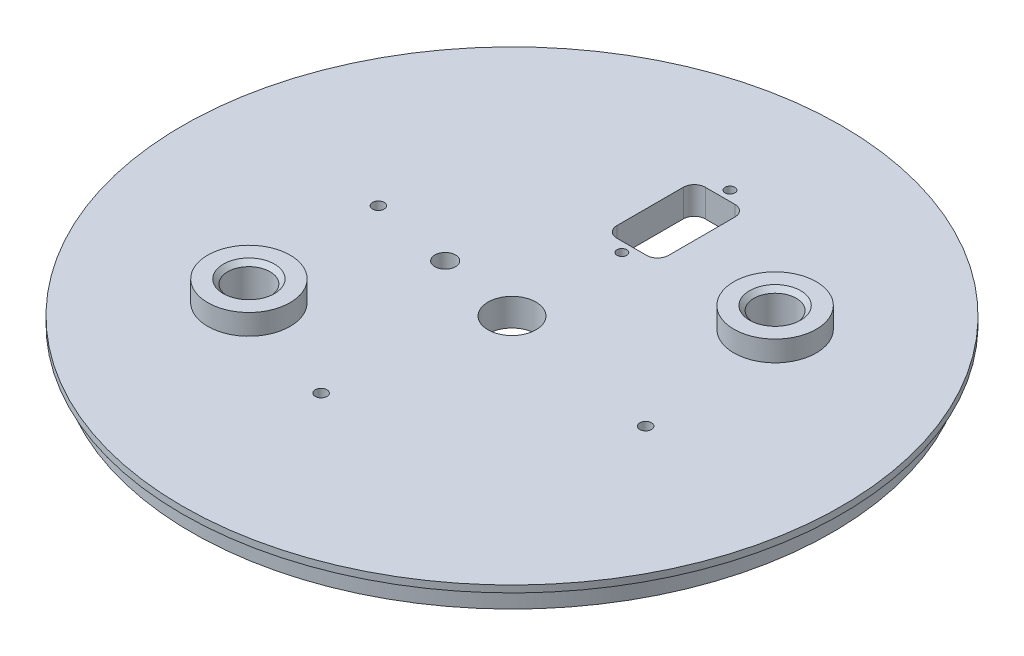
from build123d import *

# Parameters (mm, degrees)
SKETCH1_R                      = 76.2
BOSS_EXTRUDE1_DEPTH            = 11.1125
TAP_DRILL_FOR_4_40_TAP1_D      = 2.2606
CUT_EXTRUDE1_DEPTH             = 109.334517381
TAP_DRILL_FOR_6_32_TAP1_D      = 2.7051
CIRPATTERN1_COUNT              = 4
W_0_386_DIAMETER_HOLE1_D       = 9.8044
F_3_16_0_1875_DIAMETER_HOLE1_D = 4.7625
CUT_EXTRUDE4_DEPTH             = 3.175
F_7_16_0_4375_DIAMETER_HOLE1_D = 11.1125
SKETCH15_R                     = 76.2
SKETCH15_R_2                   = 74.041
CUT_EXTRUDE5_DEPTH             = 4.7625
CHAMFER2_SIZE                  = 1.016
SKETCH18_R                     = 76.2
SKETCH18_R_2                   = 9.525
SKETCH18_R_3                   = 1.35255
SKETCH18_R_4                   = 2.38125
SKETCH18_R_5                   = 5.55625
SKETCH18_R_6                   = 1.1303
CUT_EXTRUDE6_DEPTH             = 4.7625


with BuildPart() as part:
    # Sketch1 → Boss-Extrude1 (new body)
    with BuildSketch(Plane(origin=(0, 0, 0), x_dir=(1, 0, 0), z_dir=(0, 1, 0))):
        Circle(SKETCH1_R)
    extrude(amount=BOSS_EXTRUDE1_DEPTH)

    # Tap Drill for #4-40 Tap1 (through all)
    with Locations(Plane(origin=(0, 0, 0), x_dir=(-1, 0, 0), z_dir=(0, -1, 0))):
        with Locations((0, 25.4), (0, 50.400000038)):
            Hole(TAP_DRILL_FOR_4_40_TAP1_D / 2)

    # Sketch2 → Cut-Extrude1 (cut, through all)
    with BuildSketch(Plane.XZ):
        with BuildLine():
            Line((-3.429, -27.686), (3.429, -27.686))
            ThreePointArc((3.429, -27.686), (5.225051224, -28.429948776), (5.969, -30.226))
            Line((5.969, -30.226), (5.969, -45.574000038))
            ThreePointArc((5.969, -45.574000038), (5.225051224, -47.370051262), (3.429, -48.114000038))
            Line((3.429, -48.114000038), (-3.429, -48.114000038))
            ThreePointArc((-3.429, -48.114000038), (-5.225051224, -47.370051262), (-5.969, -45.574000038))
            Line((-5.969, -45.574000038), (-5.969, -30.226))
            ThreePointArc((-5.969, -30.226), (-5.225051224, -28.429948776), (-3.429, -27.686))
        make_face()
    extrude(amount=-CUT_EXTRUDE1_DEPTH, mode=Mode.SUBTRACT)

    # Tap Drill for #6-32 Tap1 (through all)
    with Locations(Plane(origin=(0, 0, 0), x_dir=(-1, 0, 0), z_dir=(0, -1, 0))):
        with Locations((37.52117539, 6.615995569)):
            tap_drill_for_6_32_tap1 = Hole(TAP_DRILL_FOR_6_32_TAP1_D / 2)

    # CirPattern1: Tap Drill for #6-32 Tap1 ×4 about axis, 1 skipped
    cirpattern1_axis = Axis((0, 0, 0), (0, 1, 0))
    add([tap_drill_for_6_32_tap1.rotate(cirpattern1_axis, i * 360 / CIRPATTERN1_COUNT) for i in range(1, CIRPATTERN1_COUNT) if i not in (3,)], mode=Mode.SUBTRACT)

    # W (0.386) Diameter Hole1 (through all)
    with Locations(Plane(origin=(0, 0, 0), x_dir=(-1, 0, 0), z_dir=(0, -1, 0))):
        with Locations((-33.077799054, 27.755568986), (33.077799054, -27.755568986)):
            Hole(W_0_386_DIAMETER_HOLE1_D / 2)

    # 3/16 (0.1875) Diameter Hole1 (through all)
    with Locations(Plane(origin=(0, 0, 0), x_dir=(-1, 0, 0), z_dir=(0, -1, 0))):
        with Locations((18.760587695, 3.307997785)):
            Hole(F_3_16_0_1875_DIAMETER_HOLE1_D / 2)

    # Sketch12 → Cut-Extrude4 (cut)
    with BuildSketch(Plane.XZ):
        with BuildLine():
            Line((19.886888313, 28.738482206), (6.498907978, 12.783308544))
            ThreePointArc((6.498907978, 12.783308544), (6.898075233, 8.220805941), (11.460577836, 8.619973196))
            Line((11.460577836, 8.619973196), (24.848558171, 24.575146858))
            ThreePointArc((24.848558171, 24.575146858), (24.449390916, 29.137649461), (19.886888313, 28.738482206))
        make_face()
    cut_extrude4 = extrude(amount=-CUT_EXTRUDE4_DEPTH, mode=Mode.SUBTRACT)

    # Mirror1: Cut-Extrude4 across plane
    add(cut_extrude4.mirror(Plane(origin=(0, 0, 0), x_dir=(-0.7660444431189792, 0, 0.6427876096865378), z_dir=(0.6427876096865379, 0, 0.7660444431189792))), mode=Mode.SUBTRACT)

    # 7/16 (0.4375) Diameter Hole1 (through all)
    with Locations(Plane(origin=(0, 0, 0), x_dir=(-1, 0, 0), z_dir=(0, -1, 0))):
        with Locations((0, 0)):
            Hole(F_7_16_0_4375_DIAMETER_HOLE1_D / 2)

    # Sketch15 → Cut-Extrude5 (cut)
    with BuildSketch(Plane.XZ):
        Circle(SKETCH15_R)
        Circle(SKETCH15_R_2, mode=Mode.SUBTRACT)
    extrude(amount=-CUT_EXTRUDE5_DEPTH, mode=Mode.SUBTRACT)

    # Chamfer2
    chamfer2_edges = [part.edges().sort_by_distance(p)[0] for p in [
        (-37.979999054, 0, 27.755568986),
        (28.175599054, 0, -27.755568986),
        (-37.979999054, 11.1125, 27.755568986),
        (28.175599054, 11.1125, -27.755568986),
    ]]
    chamfer(chamfer2_edges, length=CHAMFER2_SIZE)

    # Sketch18 → Cut-Extrude6 (cut)
    with BuildSketch(Plane(origin=(0, 11.1125, 0), x_dir=(1, 0, 0), z_dir=(0, 1, 0))):
        Circle(SKETCH18_R)
        with Locations((-33.077799054, -27.755568986)):
            Circle(SKETCH18_R_2, mode=Mode.SUBTRACT)
        with Locations((-6.615995569, -37.52117539)):
            Circle(SKETCH18_R_3, mode=Mode.SUBTRACT)
        with Locations((37.52117539, -6.615995569)):
            Circle(SKETCH18_R_3, mode=Mode.SUBTRACT)
        with Locations((-37.52117539, 6.615995569)):
            Circle(SKETCH18_R_3, mode=Mode.SUBTRACT)
        with Locations((-18.760587695, 3.307997785)):
            Circle(SKETCH18_R_4, mode=Mode.SUBTRACT)
        Circle(SKETCH18_R_5, mode=Mode.SUBTRACT)
        with Locations((0, 25.4)):
            Circle(SKETCH18_R_6, mode=Mode.SUBTRACT)
        with BuildLine():
            Line((-3.429, 48.114000038), (3.429, 48.114000038))
            ThreePointArc((3.429, 48.114000038), (5.225051224, 47.370051262), (5.969, 45.574000038))
            Line((5.969, 45.574000038), (5.969, 30.226))
            ThreePointArc((5.969, 30.226), (5.225051224, 28.429948776), (3.429, 27.686))
            Line((3.429, 27.686), (-3.429, 27.686))
            ThreePointArc((-3.429, 27.686), (-5.225051224, 28.429948776), (-5.969, 30.226))
            Line((-5.969, 30.226), (-5.969, 45.574000038))
            ThreePointArc((-5.969, 45.574000038), (-5.225051224, 47.370051262), (-3.429, 48.114000038))
        make_face(mode=Mode.SUBTRACT)
        with Locations((33.077799054, 27.755568986)):
            Circle(SKETCH18_R_2, mode=Mode.SUBTRACT)
        with Locations((0, 50.400000038)):
            Circle(SKETCH18_R_6, mode=Mode.SUBTRACT)
    extrude(amount=-CUT_EXTRUDE6_DEPTH, mode=Mode.SUBTRACT)


solid = part.part
